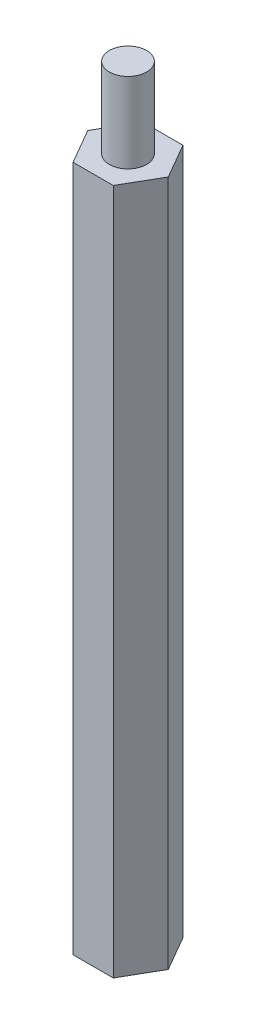
from build123d import *

# Parameters (mm, degrees)
BOSS_EXTRUDE1_DEPTH = 50.038
SKETCH2_R           = 1.3589
BOSS_EXTRUDE2_DEPTH = 5.842
SKETCH3_R           = 1.3589
CUT_EXTRUDE1_DEPTH  = 8.382


with BuildPart() as part:
    # Sketch1 → Boss-Extrude1 (new body)
    with BuildSketch(Plane(origin=(0, 0, 0), x_dir=(1, 0, 0), z_dir=(0, 1, 0))):
        Polygon((2.932939367, 0), (1.466469684, 2.54), (-1.466469684, 2.54), (-2.932939367, 0), (-1.466469684, -2.54), (1.466469684, -2.54), align=None)
    extrude(amount=BOSS_EXTRUDE1_DEPTH)

    # Sketch2 → Boss-Extrude2 (add)
    with BuildSketch(Plane(origin=(0, 50.038, 0), x_dir=(1, 0, 0), z_dir=(0, 1, 0))):
        Circle(SKETCH2_R)
    extrude(amount=BOSS_EXTRUDE2_DEPTH)

    # Sketch3 → Cut-Extrude1 (cut)
    with BuildSketch(Plane(origin=(0, 0, 0), x_dir=(-1, 0, 0), z_dir=(0, -1, 0))):
        Circle(SKETCH3_R)
    extrude(amount=-CUT_EXTRUDE1_DEPTH, mode=Mode.SUBTRACT)


solid = part.part
